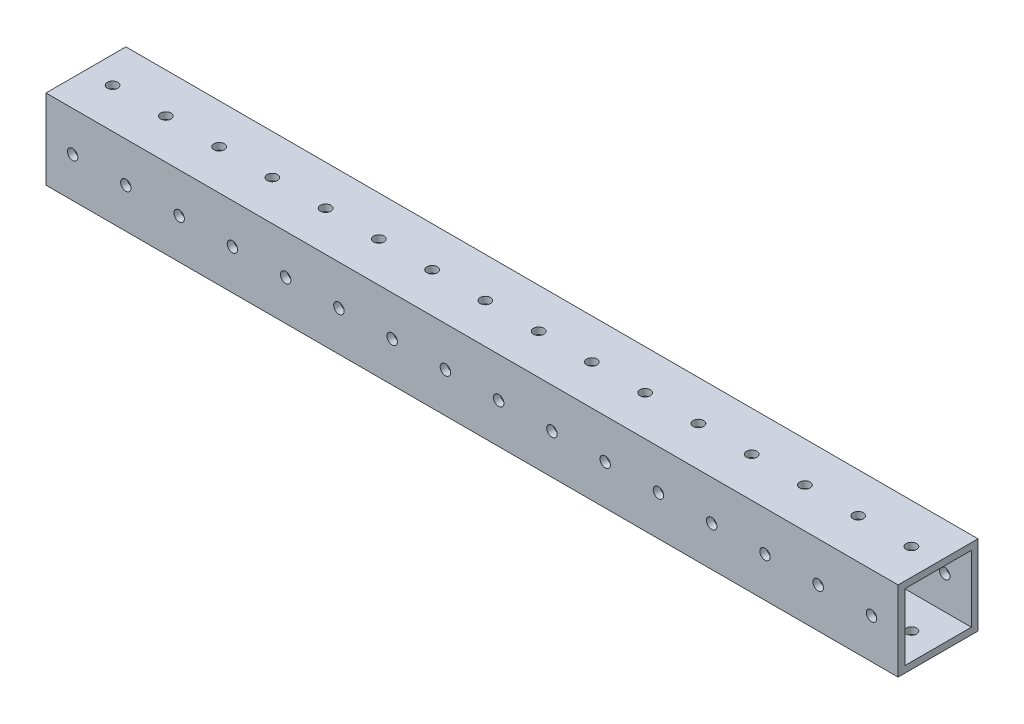
from build123d import *

# Parameters (mm, degrees)
SKETCH1_W             = 38.1
SKETCH1_H             = 38.1
SKETCH1_W_2           = 31.75
SKETCH1_H_2           = 31.75
BOSS_EXTRUDE1_DEPTH   = 203.2
SKETCH3_W             = 2.4892
SKETCH3_H             = 38.1
SKETCH3_AT_POINT_2_W  = 2.4892
SKETCH3_AT_POINT_2_H  = 38.1
LPATTERN1_START       = -19.05
LPATTERN1_OUTLINE_R   = 2.4892
LPATTERN1_DEPTH       = 38.1
LPATTERN1_2_OUTLINE_R = 2.4892
LPATTERN1_2_DEPTH     = 38.1


# Read off the part's stored shape, not the designer's step: LPattern1
with BuildPart() as part:
    # Sketch1 → Boss-Extrude1 (new, symmetric)
    with BuildSketch(Plane(origin=(0, 0, 0), x_dir=(0, 0, -1), z_dir=(1, 0, 0))):
        Rectangle(SKETCH1_W, SKETCH1_H)
        Rectangle(SKETCH1_W_2, SKETCH1_H_2, mode=Mode.SUBTRACT)
    extrude(amount=BOSS_EXTRUDE1_DEPTH, both=True)

    # Sketch3 → #9 (0.196) Diameter Hole1 (revolve, cut)
    with BuildSketch(Plane(origin=(190.5, 19.05, 0), x_dir=(0, 0, 1), z_dir=(1, 0, 0))):
        with Locations((1.2446, 19.05)):
            Rectangle(SKETCH3_W, SKETCH3_H)
    revolve(axis=Axis((190.5, 25.4, 0), (0, -1, 0)), mode=Mode.SUBTRACT)

    # Sketch3 at point 2 (carried to point 2, square into its face) → #9 (0.196) Diameter Hole1 at 2 (revolve, cut)
    with BuildSketch(Plane(origin=(190.5, 0, 19.05), x_dir=(0, -1, 0), z_dir=(1, 0, 0))):
        with Locations((1.2446, 19.05)):
            Rectangle(SKETCH3_AT_POINT_2_W, SKETCH3_AT_POINT_2_H)
    revolve(axis=Axis((190.5, 0, 25.4), (0, 0, -1)), mode=Mode.SUBTRACT)

    # LPattern1 outline → LPattern1 (cut)
    with BuildSketch(Plane.XY.offset(LPATTERN1_START)):
        with Locations((165.1, 0)):
            Circle(LPATTERN1_OUTLINE_R)
        with Locations((139.7, 0)):
            Circle(LPATTERN1_OUTLINE_R)
        with Locations((114.3, 0)):
            Circle(LPATTERN1_OUTLINE_R)
        with Locations((88.9, 0)):
            Circle(LPATTERN1_OUTLINE_R)
        with Locations((63.5, 0)):
            Circle(LPATTERN1_OUTLINE_R)
        with Locations((38.1, 0)):
            Circle(LPATTERN1_OUTLINE_R)
        with Locations((12.7, 0)):
            Circle(LPATTERN1_OUTLINE_R)
        with Locations((-12.7, 0)):
            Circle(LPATTERN1_OUTLINE_R)
        with Locations((-38.1, 0)):
            Circle(LPATTERN1_OUTLINE_R)
        with Locations((-63.5, 0)):
            Circle(LPATTERN1_OUTLINE_R)
        with Locations((-88.9, 0)):
            Circle(LPATTERN1_OUTLINE_R)
        with Locations((-114.3, 0)):
            Circle(LPATTERN1_OUTLINE_R)
        with Locations((-139.7, 0)):
            Circle(LPATTERN1_OUTLINE_R)
        with Locations((-165.1, 0)):
            Circle(LPATTERN1_OUTLINE_R)
        with Locations((-190.5, 0)):
            Circle(LPATTERN1_OUTLINE_R)
    extrude(amount=LPATTERN1_DEPTH, mode=Mode.SUBTRACT)

    # LPattern1 2 outline → LPattern1 2 (cut)
    with BuildSketch(Plane(origin=(0, 0, 0), x_dir=(1, 0, 0), z_dir=(0, 1, 0)).offset(LPATTERN1_START)):
        with Locations((165.1, 0)):
            Circle(LPATTERN1_2_OUTLINE_R)
        with Locations((139.7, 0)):
            Circle(LPATTERN1_2_OUTLINE_R)
        with Locations((114.3, 0)):
            Circle(LPATTERN1_2_OUTLINE_R)
        with Locations((88.9, 0)):
            Circle(LPATTERN1_2_OUTLINE_R)
        with Locations((63.5, 0)):
            Circle(LPATTERN1_2_OUTLINE_R)
        with Locations((38.1, 0)):
            Circle(LPATTERN1_2_OUTLINE_R)
        with Locations((12.7, 0)):
            Circle(LPATTERN1_2_OUTLINE_R)
        with Locations((-12.7, 0)):
            Circle(LPATTERN1_2_OUTLINE_R)
        with Locations((-38.1, 0)):
            Circle(LPATTERN1_2_OUTLINE_R)
        with Locations((-63.5, 0)):
            Circle(LPATTERN1_2_OUTLINE_R)
        with Locations((-88.9, 0)):
            Circle(LPATTERN1_2_OUTLINE_R)
        with Locations((-114.3, 0)):
            Circle(LPATTERN1_2_OUTLINE_R)
        with Locations((-139.7, 0)):
            Circle(LPATTERN1_2_OUTLINE_R)
        with Locations((-165.1, 0)):
            Circle(LPATTERN1_2_OUTLINE_R)
        with Locations((-190.5, 0)):
            Circle(LPATTERN1_2_OUTLINE_R)
    extrude(amount=LPATTERN1_2_DEPTH, mode=Mode.SUBTRACT)


solid = part.part
